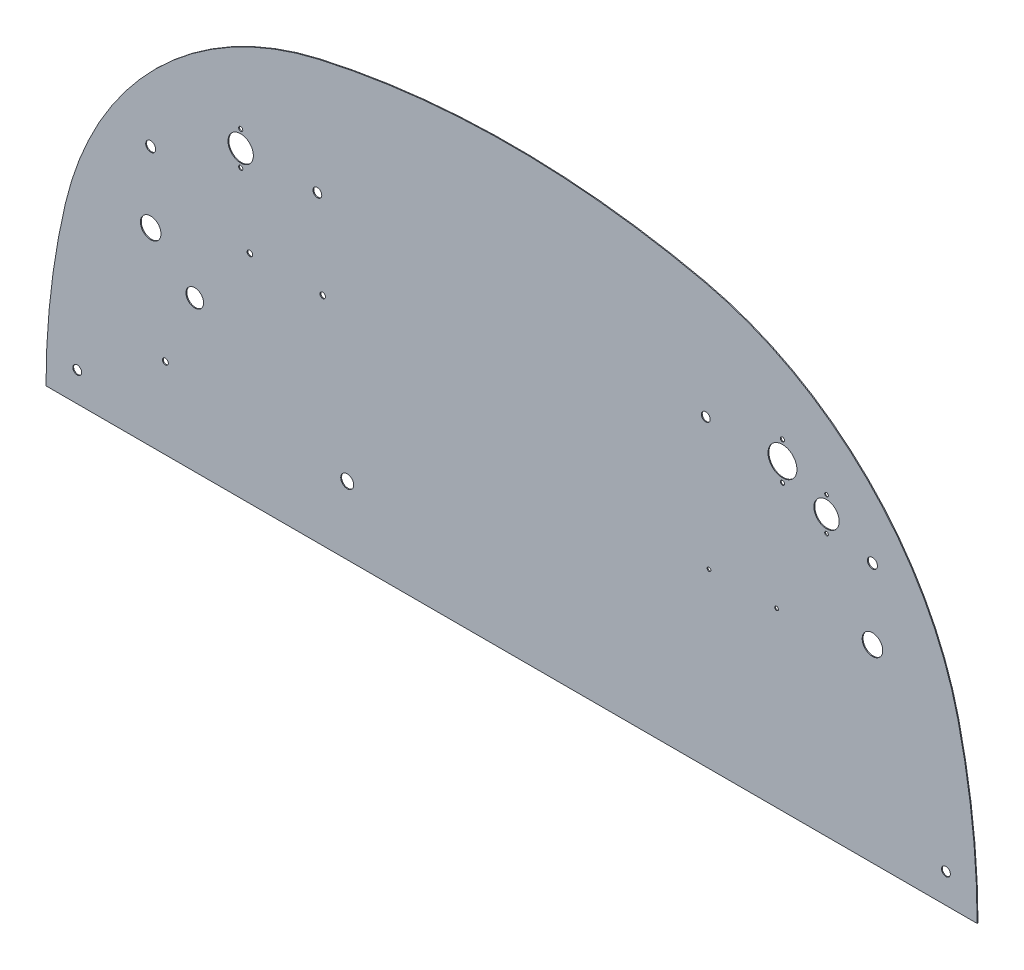
from build123d import *

# Parameters (mm, degrees)
BASE_SKETCH_R                              = 3.81
BASE_W_MOUNT_HOLES_DEPTH                   = 0.7366
THROTTLE_AND_CHOKE_CUTOUT_SKETCH_R         = 8.89
THROTTLE_AND_CHOKE_CUTOUT_SKETCH_R_2       = 4.318
THROTTLE_AND_CHOKE_CUTOUTS_DEPTH           = 856.301945634
STARTER_RELAY_MOUNT_SKETCH_R               = 2.38125
STARTER_RELAY_MOUNT_DEPTH                  = 856.301945634
OIL_PRESSURE_SENDER_CLAMP_MOUNT_SKETCH_R   = 2.54
OIL_PRESSURE_SENDER_CLAMP_MOUNT_DEPTH      = 856.301945634
STARTER_POWER_CUTOUT_SKETCH_R              = 5.588
STARTER_POWER_CUTOUT_DEPTH                 = 856.301945634
FUEL_RETURN_CUTOUT_SKETCH_R                = 7.62
FUEL_RETURN_CUTOUT_DEPTH                   = 856.301945634
BRAKE_MASTER_CYL_MOUNT_SKETCH_R            = 1.6256
BRAKE_MASTER_CYL_MOUNT_DEPTH               = 856.301945634
CUTOUT_AS012_INSTRUMENTATION_RIGHT_S_R     = 10.94994
CUTOUT_AS012_INSTRUMENTATION_RIGHT_S_R_2   = 1.8034
CUTOUT_AS012_INSTRUMENTATION_RIGHT_DEPTH   = 856.301945634
CUTOUT_AS014_TACH_AND_CDI_ENABLE_2_R       = 12.4968
CUTOUT_AS014_TACH_AND_CDI_ENABLE_2_R_2     = 1.8034
CUTOUT_AS014_TACH_AND_CDI_ENABLES_LE_DEPTH = 856.301945634
CUTOUT_AS012_INSTRUMENTATION_LEFT_SK_R     = 10.94994
CUTOUT_AS012_INSTRUMENTATION_LEFT_SK_R_2   = 1.6002
CUTOUT_AS012_INSTRUMENTATION_LEFT_DEPTH    = 856.301945634


with BuildPart() as part:
    # Base Sketch → Base w Mount Holes (new body)
    with BuildSketch(Plane.XY):
        with BuildLine():
            ThreePointArc((-10.277113366, 119.316806222), (-22.796070205, 47.439191073), (-26.9875, -25.4))
            Line((-26.9875, -25.4), (777.875, -25.4))
            ThreePointArc((777.875, -25.4), (773.683570205, 47.439191073), (761.164613366, 119.316806222))
            ThreePointArc((761.164613366, 119.316806222), (682.785171377, 259.617967861), (541.922831328, 336.984330316))
            ThreePointArc((541.922831328, 336.984330316), (375.44375, 355.6), (208.964668672, 336.984330316))
            ThreePointArc((208.964668672, 336.984330316), (68.102328623, 259.617967861), (-10.277113366, 119.316806222))
        make_face()
        Circle(BASE_SKETCH_R, mode=Mode.SUBTRACT)
        with Locations((750.8875, 0)):
            Circle(BASE_SKETCH_R, mode=Mode.SUBTRACT)
        with Locations((207.565625, 236.5375)):
            Circle(BASE_SKETCH_R, mode=Mode.SUBTRACT)
        with Locations((543.321875, 236.5375)):
            Circle(BASE_SKETCH_R, mode=Mode.SUBTRACT)
    extrude(amount=BASE_W_MOUNT_HOLES_DEPTH)

    # Throttle and Choke Cutout Sketch → Throttle and Choke Cutouts (cut, through all)
    with BuildSketch(Plane.XY.offset(0.7366)):
        with Locations((63.5, 138.1125)):
            Circle(THROTTLE_AND_CHOKE_CUTOUT_SKETCH_R)
        with Locations((63.5, 199.0725)):
            Circle(THROTTLE_AND_CHOKE_CUTOUT_SKETCH_R_2)
        with Locations((687.3875, 199.0725)):
            Circle(THROTTLE_AND_CHOKE_CUTOUT_SKETCH_R_2)
        with Locations((687.3875, 138.1125)):
            Circle(THROTTLE_AND_CHOKE_CUTOUT_SKETCH_R)
    extrude(amount=-THROTTLE_AND_CHOKE_CUTOUTS_DEPTH, mode=Mode.SUBTRACT)

    # Starter Relay Mount Sketch → Starter Relay Mount (cut, through all)
    with BuildSketch(Plane.XY.offset(0.7366)):
        with Locations((149.225, 161.925)):
            Circle(STARTER_RELAY_MOUNT_SKETCH_R)
        with Locations((212.217, 161.925)):
            Circle(STARTER_RELAY_MOUNT_SKETCH_R)
    extrude(amount=-STARTER_RELAY_MOUNT_DEPTH, mode=Mode.SUBTRACT)

    # Oil Pressure Sender Clamp Mount Sketch → Oil Pressure Sender Clamp Mount (cut, through all)
    with BuildSketch(Plane.XY.offset(0.7366)):
        with Locations((76.2, 44.45)):
            Circle(OIL_PRESSURE_SENDER_CLAMP_MOUNT_SKETCH_R)
    extrude(amount=-OIL_PRESSURE_SENDER_CLAMP_MOUNT_DEPTH, mode=Mode.SUBTRACT)

    # Starter Power Cutout Sketch → Starter Power Cutout (cut, through all)
    with BuildSketch(Plane.XY.offset(0.7366)):
        with Locations((233.3625, 33.3375)):
            Circle(STARTER_POWER_CUTOUT_SKETCH_R)
    extrude(amount=-STARTER_POWER_CUTOUT_DEPTH, mode=Mode.SUBTRACT)

    # Fuel Return Cutout Sketch → Fuel Return Cutout (cut, through all)
    with BuildSketch(Plane.XY.offset(0.7366)):
        with Locations((101.6, 104.775)):
            Circle(FUEL_RETURN_CUTOUT_SKETCH_R)
    extrude(amount=-FUEL_RETURN_CUTOUT_DEPTH, mode=Mode.SUBTRACT)

    # Brake Master Cyl Mount Sketch → Brake Master Cyl Mount (cut, through all)
    with BuildSketch(Plane.XY.offset(0.7366)):
        with Locations((546.1, 123.825)):
            Circle(BRAKE_MASTER_CYL_MOUNT_SKETCH_R)
        with Locations((604.52, 123.825)):
            Circle(BRAKE_MASTER_CYL_MOUNT_SKETCH_R)
    extrude(amount=-BRAKE_MASTER_CYL_MOUNT_DEPTH, mode=Mode.SUBTRACT)

    # Cutout - AS012 - Instrumentation Right Sketch → Cutout - AS012 - Instrumentation Right (cut, through all)
    with BuildSketch(Plane.XY.offset(0.7366)):
        with Locations((141.2875, 236.5375)):
            Circle(CUTOUT_AS012_INSTRUMENTATION_RIGHT_S_R)
        with Locations((141.2875, 221.98711)):
            Circle(CUTOUT_AS012_INSTRUMENTATION_RIGHT_S_R_2)
        with Locations((141.2875, 251.08789)):
            Circle(CUTOUT_AS012_INSTRUMENTATION_RIGHT_S_R_2)
    extrude(amount=-CUTOUT_AS012_INSTRUMENTATION_RIGHT_DEPTH, mode=Mode.SUBTRACT)

    # Cutout - AS014 - Tach and CDI Enable 2 → Cutout - AS014 - Tach and CDI Enables Le (cut, through all)
    with BuildSketch(Plane.XY.offset(0.7366)):
        with Locations((609.6, 236.5375)):
            Circle(CUTOUT_AS014_TACH_AND_CDI_ENABLE_2_R)
        with Locations((609.6, 252.78715)):
            Circle(CUTOUT_AS014_TACH_AND_CDI_ENABLE_2_R_2)
        with Locations((609.6, 220.28785)):
            Circle(CUTOUT_AS014_TACH_AND_CDI_ENABLE_2_R_2)
    extrude(amount=-CUTOUT_AS014_TACH_AND_CDI_ENABLES_LE_DEPTH, mode=Mode.SUBTRACT)

    # Cutout - AS012 - Instrumentation Left Sketch → Cutout - AS012 - Instrumentation Left (cut, through all)
    with BuildSketch(Plane.XY.offset(0.7366)):
        with Locations((647.7, 215.9)):
            Circle(CUTOUT_AS012_INSTRUMENTATION_LEFT_SK_R)
        with Locations((647.7, 230.45039)):
            Circle(CUTOUT_AS012_INSTRUMENTATION_LEFT_SK_R_2)
        with Locations((647.7, 201.34961)):
            Circle(CUTOUT_AS012_INSTRUMENTATION_LEFT_SK_R_2)
    extrude(amount=-CUTOUT_AS012_INSTRUMENTATION_LEFT_DEPTH, mode=Mode.SUBTRACT)


solid = part.part
